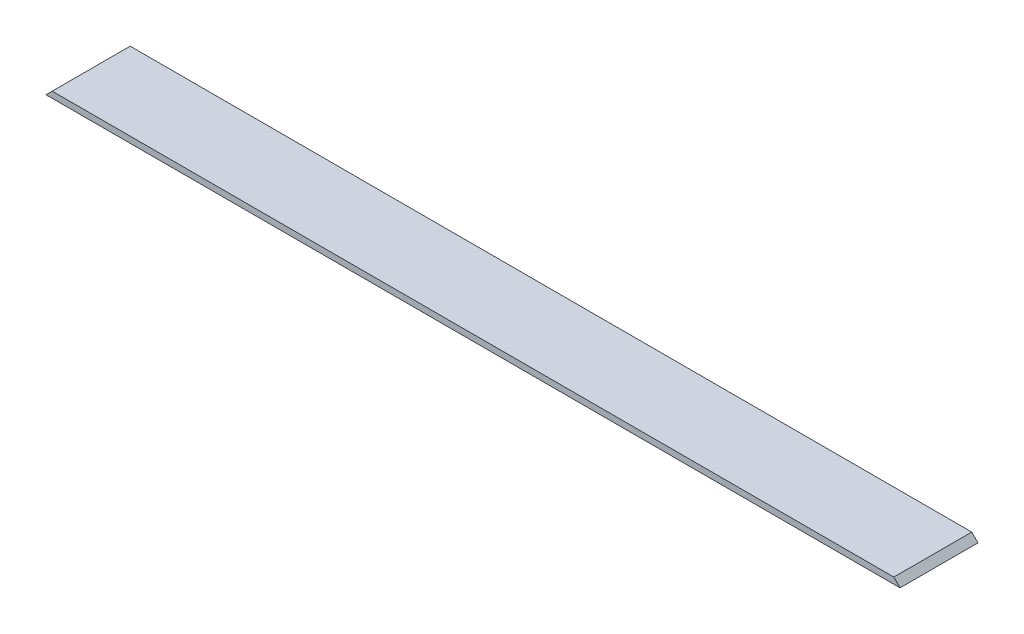
from build123d import *

# Parameters (mm, degrees)
BOSS_EXTRUDE1_DEPTH = 63.5


with BuildPart() as part:
    # Sketch1 → Boss-Extrude1 (new body)
    with BuildSketch(Plane.XY):
        Polygon((-246.201260764, 0), (449.758739236, 0), (444.678739236, 5.08), (-241.121260764, 5.08), align=None)
    extrude(amount=BOSS_EXTRUDE1_DEPTH)


solid = part.part
